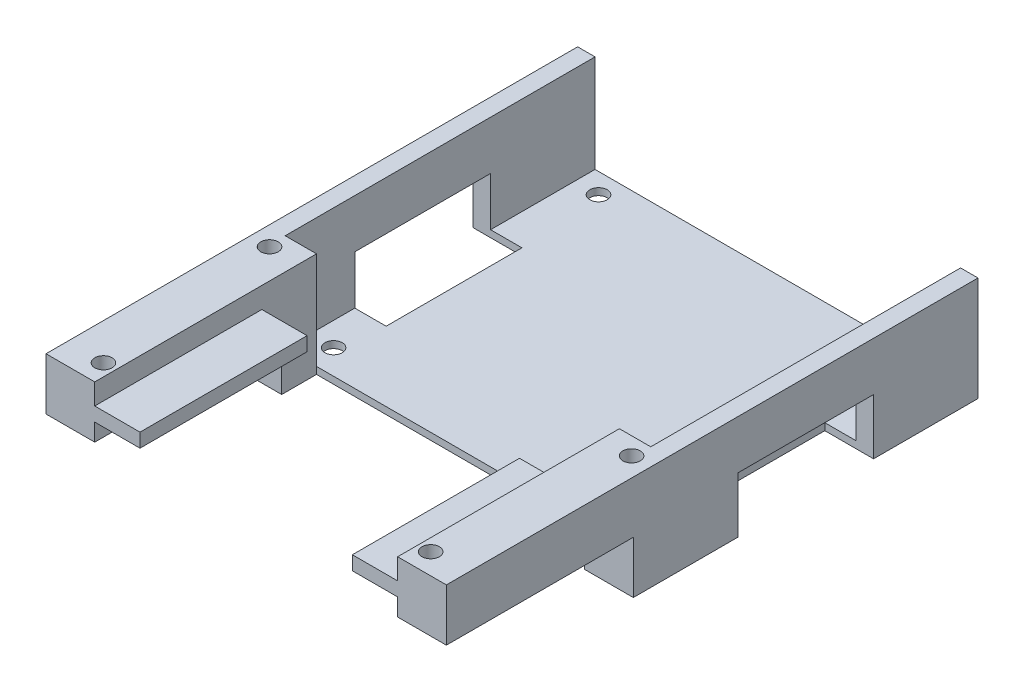
from build123d import *

# Parameters (mm, degrees)
SKETCH1_W                  = 52.5
SKETCH1_H                  = 44.5
BOSS_EXTRUDE1_DEPTH        = 1
BOSS_EXTRUDE2_DEPTH        = 15
F_2_5_2_5_DIAMETER_HOLE1_D = 2.5
SKETCH6_W                  = 6.5
SKETCH6_H                  = 2
BOSS_EXTRUDE3_DEPTH        = 24
SKETCH6_4_W                = 7
SKETCH6_4_H                = 7.5
CUT_EXTRUDE1_DEPTH         = 26.85
SKETCH8_W                  = 7
SKETCH8_H                  = 19.5
CUT_EXTRUDE2_DEPTH         = 8
CUT_EXTRUDE3_DEPTH         = 0.3


with BuildPart() as part:
    # Sketch1 → Boss-Extrude1 (new body)
    with BuildSketch(Plane(origin=(0, 0, 0), x_dir=(1, 0, 0), z_dir=(0, 1, 0))):
        with Locations((0, 54.1)):
            Rectangle(SKETCH1_W, SKETCH1_H)
    extrude(amount=BOSS_EXTRUDE1_DEPTH)

    # Sketch1<3> → Boss-Extrude2 (add)
    with BuildSketch(Plane(origin=(0, 0, 0), x_dir=(1, 0, 0), z_dir=(0, 1, 0))):
        Polygon((-26.25, 76.35), (-28.75, 76.35), (-28.75, 0), (-21.75, 0), (-21.75, 31.85), (-26.25, 31.85), align=None)
        Polygon((28.75, 76.35), (26.25, 76.35), (26.25, 31.85), (21.75, 31.85), (21.75, 0), (28.75, 0), align=None)
    extrude(amount=BOSS_EXTRUDE2_DEPTH)

    # Ø2.5 (2.5) Diameter Hole1 (through all)
    with Locations(Plane(origin=(0, 0, 0), x_dir=(-1, 0, 0), z_dir=(0, -1, 0))):
        with Locations((-22.85, 73.45), (22.85, 73.45), (26, 29.35), (22.85, 35.4), (-22.85, 35.4), (-26, 29.35), (-23.5, 3), (23.5, 3), (-30.25, 71.35), (30.25, 71.35)):
            Hole(F_2_5_2_5_DIAMETER_HOLE1_D / 2)

    # Sketch6 → Boss-Extrude3 (add)
    with BuildSketch(Plane.XY):
        with Locations((-18.5, 11)):
            Rectangle(SKETCH6_W, SKETCH6_H)
        with Locations((18.5, 11)):
            Rectangle(SKETCH6_W, SKETCH6_H)
    extrude(amount=-BOSS_EXTRUDE3_DEPTH)

    # Sketch6<4> → Cut-Extrude1 (cut)
    with BuildSketch(Plane.XY):
        with Locations((-25.25, 3.75)):
            Rectangle(SKETCH6_4_W, SKETCH6_4_H)
        with Locations((25.25, 3.75)):
            Rectangle(SKETCH6_4_W, SKETCH6_4_H)
    extrude(amount=-CUT_EXTRUDE1_DEPTH, mode=Mode.SUBTRACT)

    # Sketch8 → Cut-Extrude2 (cut)
    with BuildSketch(Plane.XZ):
        with Locations((-25.25, -51.6)):
            Rectangle(SKETCH8_W, SKETCH8_H)
        with Locations((25.25, -51.6)):
            Rectangle(SKETCH8_W, SKETCH8_H)
    extrude(amount=-CUT_EXTRUDE2_DEPTH, mode=Mode.SUBTRACT)

    # Sketch9 → Cut-Extrude3 (cut)
    with BuildSketch(Plane.XZ):
        Polygon((-3.689843301, -66.963585904), (-0.766939618, -56.191794443), (-9.599348257, -56.191794443), (4.207929605, -40.061796941), (3.001024061, -51.044637389), (10.995078197, -51.044637389), align=None)
    extrude(amount=-CUT_EXTRUDE3_DEPTH, mode=Mode.SUBTRACT)


solid = part.part
